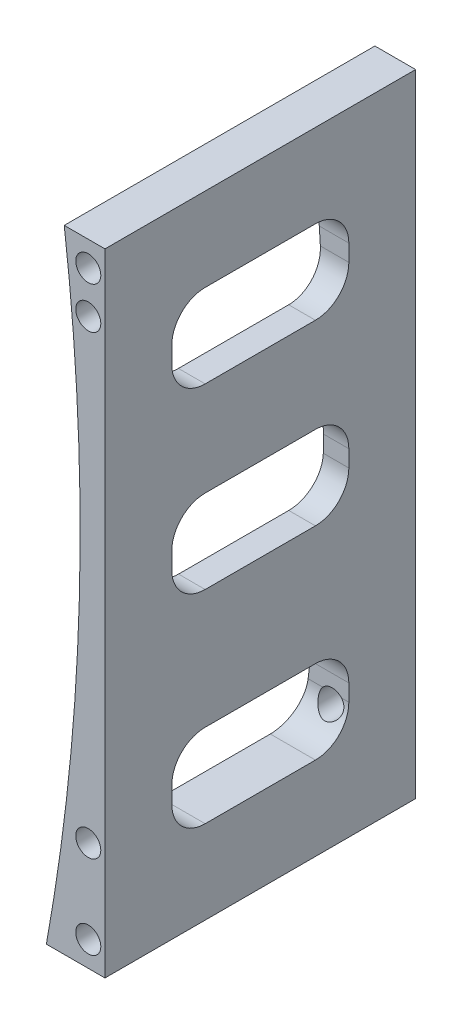
from build123d import *

# Parameters (mm, degrees)
RESSALTO_EXTRUS_O1_DEPTH = 37.2
FILETE3_R                = 10
FILETE4_R                = 10
ESBO_O3_W                = 64.493903811
ESBO_O3_H                = 22.028162523
CORTE_EXTRUS_O2_DEPTH    = 126.622328301
ESBO_O4_W                = 55.088928671
ESBO_O4_H                = 123.119514717
CORTE_EXTRUS_O3_DEPTH    = 126.622328159
ESBO_O5_W                = 12.155718474
ESBO_O5_H                = 25
CORTE_EXTRUS_O4_DEPTH    = 120.46824597
CORTE_EXTRUS_O5_DEPTH    = 96.020543125
ESBO_O7_R                = 1.5
CORTE_EXTRUS_O6_DEPTH    = 97.384450815


with BuildPart() as part:
    # Esboço1 → Ressalto-extrusão1 (new body)
    with BuildSketch(Plane.XY):
        with BuildLine():
            ThreePointArc((-10, 0), (0, -10), (10, 0))
            Line((10, 0), (20, 0))
            ThreePointArc((20, 0), (14.071698091, 40.495175194), (14.829943665, 81.414963086))
            ThreePointArc((14.829943665, 81.414963086), (11.193742071, 116.066691762), (-16.576524471, 95.024435265))
            Line((-16.576524471, 95.024435265), (-16.487894969, 94.437265709))
            Line((-16.487894969, 94.437265709), (-16.369382775, 93.652123615))
            ThreePointArc((-16.369382775, 93.652123615), (-13.756795166, 46.654405302), (-20, 0))
            Line((-20, 0), (-10, 0))
        make_face()
    extrude(amount=RESSALTO_EXTRUS_O1_DEPTH)

    # Filete3
    # the kernel refuses this fillet: 10 mm, written as the material it takes off along each edge
    with BuildSketch(Plane(origin=(20, 0, -29.463728433), x_dir=(-0.20232831186330175, 0.9793177493635794, 0), z_dir=(0, 0, 1))) as filete3_piece_1:
        with BuildLine():
            CenterArc((12.021201201, 9.997221658), FILETE3_R, 181.169168083, 87.480189)
            Line((2.023283119, 9.793177494), (1.823324757, 9.78909661))
            ThreePointArc((1.823324757, 9.78909661), (0.815778009, 4.937054409), (-0.19586355, 0.040465662))
            Line((-0.19586355, 0.040465662), (0.004714197, -0.199944433))
            ThreePointArc((0.004714197, -0.199944433), (5.892745687, -0.130541448), (11.780777177, -0.199944433))
            Line((11.780777177, -0.199944433), (11.785491373, 0))
        make_face()
    extrude(amount=96.127456867, mode=Mode.SUBTRACT)
    with BuildSketch(Plane(origin=(-20, 0, -29.463728433), x_dir=(1, 0, 0), z_dir=(0, 0, 1))) as filete3_piece_2:
        with BuildLine():
            CenterArc((12.222685959, 9.749854723), FILETE3_R, 169.67749742, 87.480189)
            Line((2.384538574, 11.541740887), (2.187775626, 11.57757861))
            ThreePointArc((2.187775626, 11.57757861), (1.06442773, 5.797282674), (-0.194855317, 0.045071116))
            Line((-0.194855317, 0.045071116), (0, -0.2))
            ThreePointArc((0, -0.2), (5, -0.2), (9.955546281, -0.194997094))
            Line((9.955546281, -0.194997094), (10, 0))
        make_face()
    extrude(amount=96.127456867, mode=Mode.SUBTRACT)

    # Filete4
    filete4_edges = [part.edges().sort_by_distance(p)[0] for p in [
        (10, 0, 18.6),
        (-10, 0, 18.6),
    ]]
    fillet(filete4_edges, radius=FILETE4_R)

    # Esboço3 → Corte-extrusão2 (cut, through all)
    with BuildSketch(Plane.XY.offset(37.2)):
        with Locations((-2.119172362, 0.527659626)):
            Rectangle(ESBO_O3_W, ESBO_O3_H)
    extrude(amount=-CORTE_EXTRUS_O2_DEPTH, mode=Mode.SUBTRACT)

    # Esboço4 → Corte-extrusão3 (cut, through all)
    with BuildSketch(Plane.XY.offset(37.2)):
        with Locations((16.946535692, 73.101498246)):
            Rectangle(ESBO_O4_W, ESBO_O4_H)
    extrude(amount=-CORTE_EXTRUS_O3_DEPTH, mode=Mode.SUBTRACT)

    # Esboço5 → Corte-extrusão4 (cut, through all)
    with BuildSketch(Plane.XY.offset(37.2)):
        with Locations((-16.675787881, 99.653989291)):
            Rectangle(ESBO_O5_W, ESBO_O5_H)
    extrude(amount=-CORTE_EXTRUS_O4_DEPTH, mode=Mode.SUBTRACT)

    # Esboço6 → Corte-extrusão5 (cut, through all)
    with BuildSketch(Plane(origin=(-10.597928644, 0, 0), x_dir=(0, 0, -1), z_dir=(1, 0, 0))):
        with BuildLine():
            Line((-25.2, 77.153989291), (-12, 77.153989291))
            ThreePointArc((-12, 77.153989291), (-9.171572875, 75.982416416), (-8, 73.153989291))
            Line((-8, 73.153989291), (-8, 71.153989291))
            ThreePointArc((-8, 71.153989291), (-9.171572875, 68.325562166), (-12, 67.153989291))
            Line((-12, 67.153989291), (-25.2, 67.153989291))
            ThreePointArc((-25.2, 67.153989291), (-28.028427125, 68.325562166), (-29.2, 71.153989291))
            Line((-29.2, 71.153989291), (-29.2, 73.153989291))
            ThreePointArc((-29.2, 73.153989291), (-28.028427125, 75.982416416), (-25.2, 77.153989291))
        make_face()
        with BuildLine():
            Line((-25.2, 55.831740887), (-12, 55.831740887))
            ThreePointArc((-12, 55.831740887), (-9.171572875, 54.660168012), (-8, 51.831740887))
            Line((-8, 51.831740887), (-8, 49.831740887))
            ThreePointArc((-8, 49.831740887), (-9.171572875, 47.003313762), (-12, 45.831740887))
            Line((-12, 45.831740887), (-25.2, 45.831740887))
            ThreePointArc((-25.2, 45.831740887), (-28.028427125, 47.003313762), (-29.2, 49.831740887))
            Line((-29.2, 49.831740887), (-29.2, 51.831740887))
            ThreePointArc((-29.2, 51.831740887), (-28.028427125, 54.660168012), (-25.2, 55.831740887))
        make_face()
        with BuildLine():
            Line((-25.2, 31.541740887), (-12, 31.541740887))
            ThreePointArc((-12, 31.541740887), (-9.171572875, 30.370168012), (-8, 27.541740887))
            Line((-8, 27.541740887), (-8, 25.541740887))
            ThreePointArc((-8, 25.541740887), (-9.171572875, 22.713313762), (-12, 21.541740887))
            Line((-12, 21.541740887), (-25.2, 21.541740887))
            ThreePointArc((-25.2, 21.541740887), (-28.028427125, 22.713313762), (-29.2, 25.541740887))
            Line((-29.2, 25.541740887), (-29.2, 27.541740887))
            ThreePointArc((-29.2, 27.541740887), (-28.028427125, 30.370168012), (-25.2, 31.541740887))
        make_face()
    extrude(amount=-CORTE_EXTRUS_O5_DEPTH, mode=Mode.SUBTRACT)

    # Esboço7 → Corte-extrusão6 (cut, through all)
    with BuildSketch(Plane.XY.offset(37.2)):
        with Locations((-12.597928644, 14.541740887)):
            Circle(ESBO_O7_R)
        with Locations((-12.597928644, 84.153989291)):
            Circle(ESBO_O7_R)
        with Locations((-12.597928644, 79.153989291)):
            Circle(ESBO_O7_R)
        with Locations((-12.597928644, 24.541740887)):
            Circle(ESBO_O7_R)
    extrude(amount=-CORTE_EXTRUS_O6_DEPTH, mode=Mode.SUBTRACT)


solid = part.part
